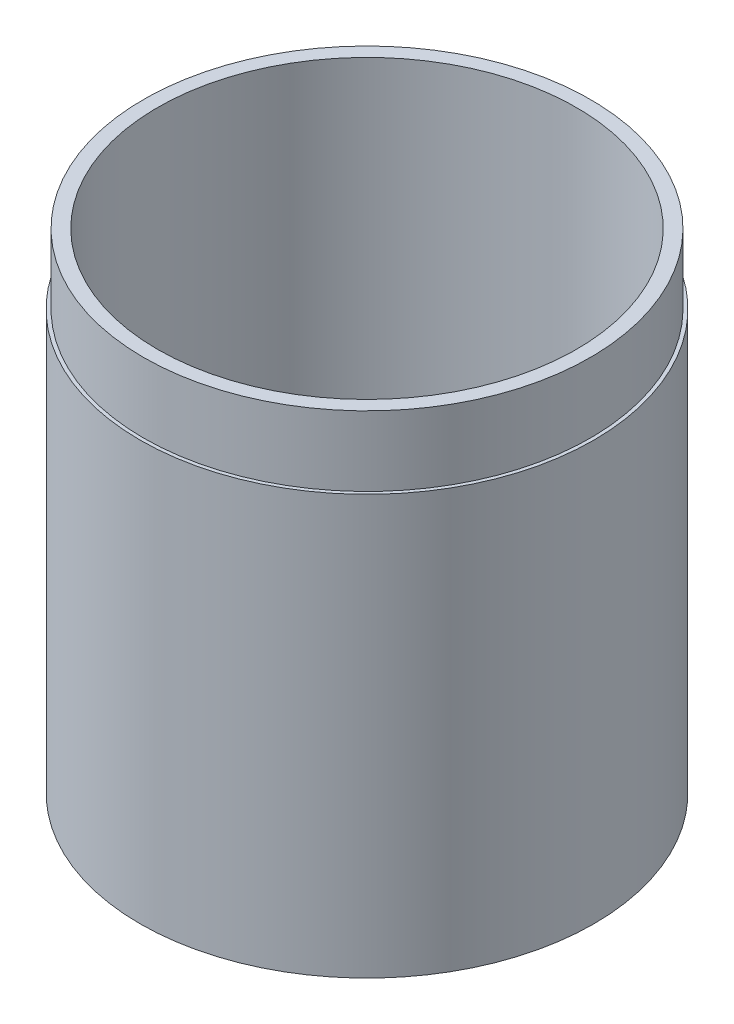
from build123d import *


with BuildPart() as part:
    # Szkic1 → Obrót1 (revolve)
    with BuildSketch(Plane.XY):
        Polygon((60, -60), (62, -60), (62, -80), (65, -80), (65, 40), (64, 40), (64, 60), (60, 60), align=None)
    revolve(axis=Axis((0, 74.447856623, 0), (0, -1, 0)))


solid = part.part
